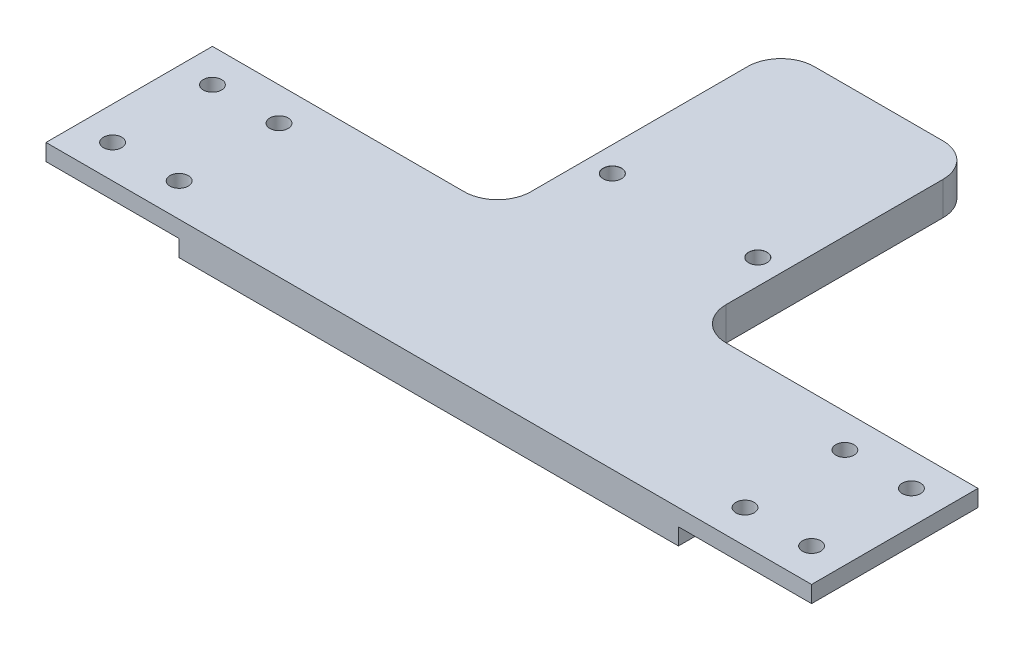
from build123d import *

# Parameters (mm, degrees)
SKETCH1_W                      = 58.7
SKETCH1_H                      = 85.15
SKETCH1_W_2                    = 230
SKETCH1_H_2                    = 50
BOSS_EXTRUDE1_DEPTH            = 10
M5_CLEARANCE_HOLE1_D           = 5.5
M5_CLEARANCE_HOLE1_CSINK_D     = 5.55
M5_CLEARANCE_HOLE1_CSINK_ANGLE = 90
SKETCH5_W                      = 40
SKETCH5_H                      = 50
CUT_EXTRUDE1_DEPTH             = 5
FILLET1_R                      = 10


# Read off the part's stored shape, not the designer's step: M5 Clearance Hole2
with BuildPart() as part:
    # Sketch1 → Boss-Extrude1 (new body)
    with BuildSketch(Plane(origin=(0, 0, 0), x_dir=(1, 0, 0), z_dir=(0, 1, 0))):
        with Locations((0, 67.575)):
            Rectangle(SKETCH1_W, SKETCH1_H)
        Rectangle(SKETCH1_W_2, SKETCH1_H_2)
    extrude(amount=BOSS_EXTRUDE1_DEPTH)

    # M5 Clearance Hole1 (through all)
    with Locations(Plane(origin=(0, 10, 0), x_dir=(1, 0, 0), z_dir=(0, 1, 0))):
        with Locations((-21.85, 52), (21.85, 52)):
            CounterSinkHole(M5_CLEARANCE_HOLE1_D / 2, M5_CLEARANCE_HOLE1_CSINK_D / 2, counter_sink_angle=M5_CLEARANCE_HOLE1_CSINK_ANGLE)

    # Sketch5 → Cut-Extrude1 (cut)
    with BuildSketch(Plane.XZ):
        with Locations((-95, 0)):
            Rectangle(SKETCH5_W, SKETCH5_H)
        with Locations((95, 0)):
            Rectangle(SKETCH5_W, SKETCH5_H)
    extrude(amount=-CUT_EXTRUDE1_DEPTH, mode=Mode.SUBTRACT)

    # M5 Clearance Hole2 outline → M5 Clearance Hole2 (revolve, cut)
    with BuildSketch(Plane(origin=(-85, 0, -15), x_dir=(1, 0, 0), z_dir=(0, 0, 1))):
        Polygon((2.75, 5.025), (2.75, 10), (0, 10), (0, 5), (2.775, 5), align=None)
    revolve(axis=Axis((-85, 0, -15), (0, 1, 0)), mode=Mode.SUBTRACT)

    # M5 Clearance Hole2 2 outline → M5 Clearance Hole2 2 (revolve, cut)
    with BuildSketch(Plane(origin=(-85, 0, 15), x_dir=(1, 0, 0), z_dir=(0, 0, 1))):
        Polygon((2.75, 5.025), (2.75, 10), (0, 10), (0, 5), (2.775, 5), align=None)
    revolve(axis=Axis((-85, 0, 15), (0, 1, 0)), mode=Mode.SUBTRACT)

    # M5 Clearance Hole2 3 outline → M5 Clearance Hole2 3 (revolve, cut)
    with BuildSketch(Plane(origin=(-105, 0, -15), x_dir=(1, 0, 0), z_dir=(0, 0, 1))):
        Polygon((2.75, 5.025), (2.75, 10), (0, 10), (0, 5), (2.775, 5), align=None)
    revolve(axis=Axis((-105, 0, -15), (0, 1, 0)), mode=Mode.SUBTRACT)

    # M5 Clearance Hole2 4 outline → M5 Clearance Hole2 4 (revolve, cut)
    with BuildSketch(Plane(origin=(-105, 0, 15), x_dir=(1, 0, 0), z_dir=(0, 0, 1))):
        Polygon((2.75, 5.025), (2.75, 10), (0, 10), (0, 5), (2.775, 5), align=None)
    revolve(axis=Axis((-105, 0, 15), (0, 1, 0)), mode=Mode.SUBTRACT)

    # M5 Clearance Hole2 5 outline → M5 Clearance Hole2 5 (revolve, cut)
    with BuildSketch(Plane(origin=(105, 0, -15), x_dir=(1, 0, 0), z_dir=(0, 0, 1))):
        Polygon((2.75, 5.025), (2.75, 10), (0, 10), (0, 5), (2.775, 5), align=None)
    revolve(axis=Axis((105, 0, -15), (0, 1, 0)), mode=Mode.SUBTRACT)

    # M5 Clearance Hole2 6 outline → M5 Clearance Hole2 6 (revolve, cut)
    with BuildSketch(Plane(origin=(105, 0, 15), x_dir=(1, 0, 0), z_dir=(0, 0, 1))):
        Polygon((2.75, 5.025), (2.75, 10), (0, 10), (0, 5), (2.775, 5), align=None)
    revolve(axis=Axis((105, 0, 15), (0, 1, 0)), mode=Mode.SUBTRACT)

    # M5 Clearance Hole2 7 outline → M5 Clearance Hole2 7 (revolve, cut)
    with BuildSketch(Plane(origin=(85, 0, -15), x_dir=(1, 0, 0), z_dir=(0, 0, 1))):
        Polygon((2.75, 5.025), (2.75, 10), (0, 10), (0, 5), (2.775, 5), align=None)
    revolve(axis=Axis((85, 0, -15), (0, 1, 0)), mode=Mode.SUBTRACT)

    # M5 Clearance Hole2 8 outline → M5 Clearance Hole2 8 (revolve, cut)
    with BuildSketch(Plane(origin=(85, 0, 15), x_dir=(1, 0, 0), z_dir=(0, 0, 1))):
        Polygon((2.75, 5.025), (2.75, 10), (0, 10), (0, 5), (2.775, 5), align=None)
    revolve(axis=Axis((85, 0, 15), (0, 1, 0)), mode=Mode.SUBTRACT)

    # Fillet1
    fillet1_edges = [part.edges().sort_by_distance(p)[0] for p in [
        (-29.35, 5, -110.15),
        (29.35, 5, -110.15),
        (29.35, 5, -25),
        (-29.35, 5, -25),
    ]]
    fillet(fillet1_edges, radius=FILLET1_R)


solid = part.part
